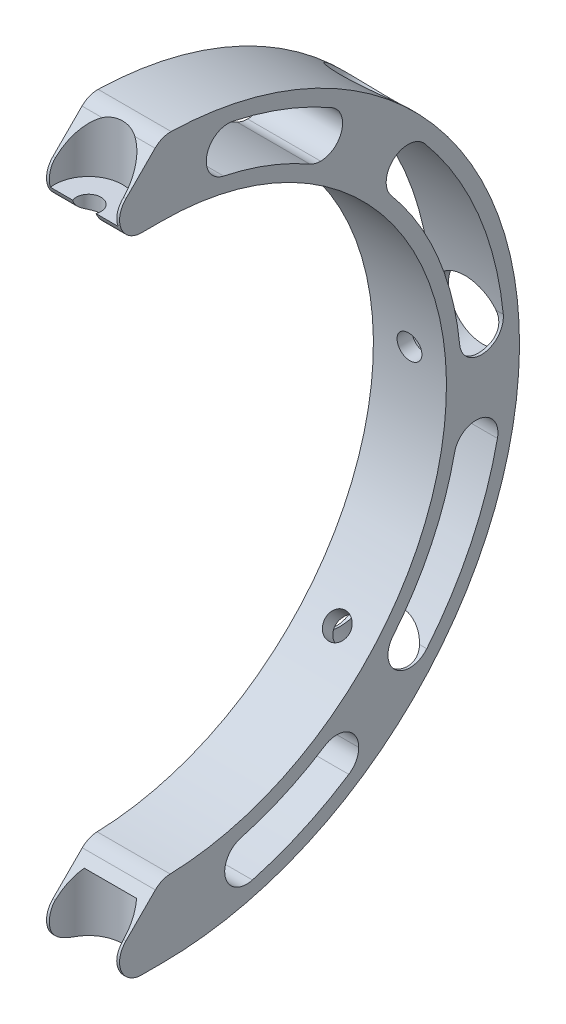
from build123d import *

# Parameters (mm, degrees)
BOSS_EXTRUDE1_DEPTH                          = 10
FILLET1_R                                    = 3
CBORE_FOR_M3_HEX_HEAD_CAP_SCREW3_D           = 3.4
CBORE_FOR_M3_HEX_HEAD_CAP_SCREW3_CBORE_D     = 9.351
CBORE_FOR_M3_HEX_HEAD_CAP_SCREW3_CBORE_DEPTH = 8
CIRPATTERN2_COUNT                            = 2
CIRPATTERN2_ANGLE                            = 45
CBORE_FOR_M3_HEX_HEAD_CAP_SCREW4_D           = 3.4
CBORE_FOR_M3_HEX_HEAD_CAP_SCREW4_CBORE_D     = 9.351
CBORE_FOR_M3_HEX_HEAD_CAP_SCREW4_CBORE_DEPTH = 8
CBORE_FOR_M3_HEX_HEAD_CAP_SCREW5_D           = 3.4
CBORE_FOR_M3_HEX_HEAD_CAP_SCREW5_CBORE_D     = 9.351
CBORE_FOR_M3_HEX_HEAD_CAP_SCREW5_CBORE_DEPTH = 8


# Read off the part's stored shape, not the designer's step: CirPattern1
with BuildPart() as part:
    # Sketch1 → Boss-Extrude1 (new body)
    with BuildSketch(Plane(origin=(0, 0, 0), x_dir=(0, 0, -1), z_dir=(1, 0, 0))):
        with BuildLine():
            ThreePointArc((0, -49), (49, 0), (0, 49))
            Line((0, 49), (-10, 39))
            Line((-10, 39), (0, 39))
            ThreePointArc((0, 39), (39, 0), (0, -39))
            Line((0, -39), (-10, -49))
            Line((-10, -49), (0, -49))
        make_face()
        with BuildLine():
            Line((40.908544193, -2.736971318), (46.29300526, -8.121432385))
            ThreePointArc((46.29300526, -8.121432385), (40.967770261, -23.035663651), (30.991378029, -35.33460751))
            Line((30.991378029, -35.33460751), (30.991378029, -26.842773476))
            ThreePointArc((30.991378029, -26.842773476), (37.916647113, -15.598970213), (40.908544193, -2.736971318))
        make_face(mode=Mode.SUBTRACT)
        with BuildLine():
            ThreePointArc((26.991378029, -38.476817853), (15.538234252, -44.357223497), (2.919169517, -46.909257608))
            Line((2.919169517, -46.909257608), (10.089168451, -39.739258674))
            ThreePointArc((10.089168451, -39.739258674), (19.064180672, -36.298168209), (26.991378029, -30.862039986))
            Line((26.991378029, -30.862039986), (26.991378029, -38.476817853))
        make_face(mode=Mode.SUBTRACT)
        with BuildLine():
            ThreePointArc((8.121432385, 46.29300526), (20.378102722, 42.352484336), (31.105689594, 35.234018716))
            Line((31.105689594, 35.234018716), (20.96577986, 35.234018716))
            ThreePointArc((20.96577986, 35.234018716), (12.186269454, 39.147092316), (2.736971318, 40.908544193))
            Line((2.736971318, 40.908544193), (8.121432385, 46.29300526))
        make_face(mode=Mode.SUBTRACT)
        with BuildLine():
            ThreePointArc((35.120308582, 31.234018716), (44.452505287, 15.263511185), (46.899554143, -3.071127019))
            Line((46.899554143, -3.071127019), (40.894920713, 2.933506412))
            ThreePointArc((40.894920713, 2.933506412), (36.575577954, 18.526389215), (26.56004659, 31.234018716))
            Line((26.56004659, 31.234018716), (35.120308582, 31.234018716))
        make_face(mode=Mode.SUBTRACT)
    extrude(amount=BOSS_EXTRUDE1_DEPTH)

    # Fillet1
    fillet1_edges = [part.edges().sort_by_distance(p)[0] for p in [
        (5, 46.29300526, -8.121432385),
        (5, 40.908544193, -2.736971318),
        (5, 35.234018716, -20.96577986),
        (5, 35.234018716, -31.105689594),
        (5, 31.234018716, -35.120308582),
        (5, 31.234018716, -26.56004659),
        (5, 2.933506412, -40.894920713),
        (5, -3.071127019, -46.899554143),
        (5, -8.121432385, -46.29300526),
        (5, -2.736971318, -40.908544193),
        (5, -26.842773476, -30.991378029),
        (5, -35.33460751, -30.991378029),
        (5, -46.909257608, -2.919169517),
        (5, -38.476817853, -26.991378029),
        (5, -30.862039986, -26.991378029),
        (5, -39.739258674, -10.089168451),
        (5, -49, 10),
        (5, -39, 0),
        (5, 49, 0),
        (5, 39, 10),
    ]]
    fillet(fillet1_edges, radius=FILLET1_R - 0.0001)  # a hair under: the kernel refuses the full size

    # CBORE for M3 Hex Head Cap Screw3 (through all)
    with Locations(Plane(origin=(0, 0, -49), x_dir=(1, 0, 0), z_dir=(0, 0, -1))):
        with Locations((5, -2.158376201)):
            cbore_for_m3_hex_head_cap_screw3 = CounterBoreHole(CBORE_FOR_M3_HEX_HEAD_CAP_SCREW3_D / 2, CBORE_FOR_M3_HEX_HEAD_CAP_SCREW3_CBORE_D / 2, CBORE_FOR_M3_HEX_HEAD_CAP_SCREW3_CBORE_DEPTH)

    # CirPattern1 outline → CirPattern1 (revolve, cut)
    with BuildSketch(Plane(origin=(5, 1.526202448, 1.526202448), x_dir=(1, 0, 0), z_dir=(0, 0.707106781186546, 0.707106781186549))):
        Polygon((1.7, 41), (4.6755, 41), (4.6755, 49.000044178), (0, 49.000044178), (0, 38.808670668), (1.7, 38.808670668), align=None)
    revolve(axis=Axis((5, 1.526202448, 1.526202448), (0, 0.707106781186549, -0.707106781186546)), mode=Mode.SUBTRACT)

    # CirPattern2: CBORE for M3 Hex Head Cap Screw3 ×2 about axis
    cirpattern2_axis = Axis((0, 0, 0), (-1, 0, 0))
    for i in range(1, CIRPATTERN2_COUNT):
        add(cbore_for_m3_hex_head_cap_screw3.rotate(cirpattern2_axis, i * CIRPATTERN2_ANGLE / (CIRPATTERN2_COUNT - 1)), mode=Mode.SUBTRACT)

    # CBORE for M3 Hex Head Cap Screw4 (through all)
    with Locations(Plane(origin=(0, -49, 0), x_dir=(-1, 0, 0), z_dir=(0, -1, 0))):
        with Locations((-5, -5)):
            CounterBoreHole(CBORE_FOR_M3_HEX_HEAD_CAP_SCREW4_D / 2, CBORE_FOR_M3_HEX_HEAD_CAP_SCREW4_CBORE_D / 2, CBORE_FOR_M3_HEX_HEAD_CAP_SCREW4_CBORE_DEPTH)

    # CBORE for M3 Hex Head Cap Screw5 (through all)
    with Locations(Plane(origin=(0, 49, 0), x_dir=(-1, 0, 0), z_dir=(0, 1, 0))):
        with Locations((-5, 5)):
            CounterBoreHole(CBORE_FOR_M3_HEX_HEAD_CAP_SCREW5_D / 2, CBORE_FOR_M3_HEX_HEAD_CAP_SCREW5_CBORE_D / 2, CBORE_FOR_M3_HEX_HEAD_CAP_SCREW5_CBORE_DEPTH)


solid = part.part
